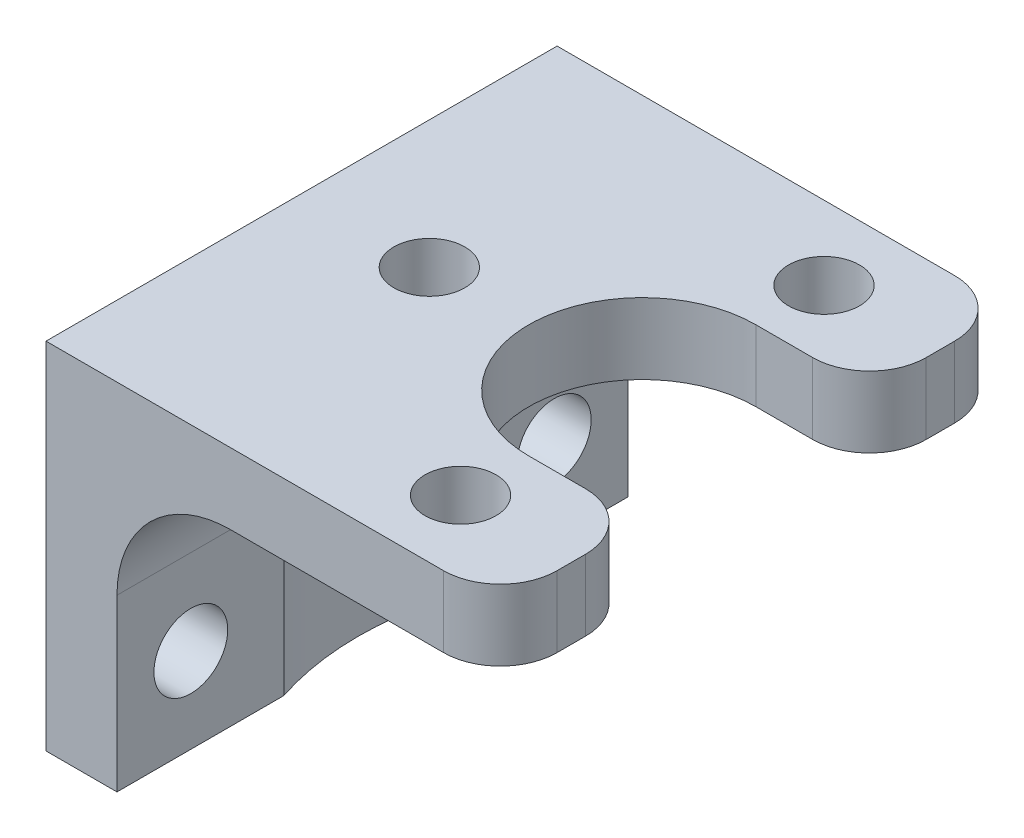
from build123d import *

# Parameters (mm, degrees)
SKETCH1_W           = 20.32
SKETCH1_H           = 22.86
BOSS_EXTRUDE1_DEPTH = 3.175
FILLET1_R           = 2.54
FILLET2_R           = 2.54
CUT_EXTRUDE2_DEPTH  = 16.618934823
FILLET3_R           = 2.54
FILLET4_R           = 2.54
SKETCH4_W           = 3.175
SKETCH4_H           = 22.86
BOSS_EXTRUDE2_DEPTH = 12.7
FILLET6_R           = 5.08
SKETCH3_R           = 1.5875
CUT_EXTRUDE3_DEPTH  = 6.35
SKETCH5_R           = 12.7
CUT_EXTRUDE4_DEPTH  = 20.878644377
SKETCH6_R           = 1.651
CUT_EXTRUDE5_DEPTH  = 25.205080661


with BuildPart() as part:
    # Sketch1 → Boss-Extrude1 (new body)
    with BuildSketch(Plane(origin=(0, 0, 0), x_dir=(1, 0, 0), z_dir=(0, 1, 0))):
        Rectangle(SKETCH1_W, SKETCH1_H)
    extrude(amount=BOSS_EXTRUDE1_DEPTH)

    # Fillet1
    fillet1_edges = [part.edges().sort_by_distance(p)[0] for p in [
        (10.16, 1.5875, -11.43),
    ]]
    fillet(fillet1_edges, radius=FILLET1_R)

    # Fillet2
    fillet2_edges = [part.edges().sort_by_distance(p)[0] for p in [
        (10.16, 1.5875, 11.43),
    ]]
    fillet(fillet2_edges, radius=FILLET2_R)

    # Sketch2 → Cut-Extrude2 (cut, through all)
    with BuildSketch(Plane.XZ):
        with BuildLine():
            Line((5.08, -5.08), (10.16, -5.08))
            Line((10.16, -5.08), (10.16, 5.08))
            Line((10.16, 5.08), (5.08, 5.08))
            ThreePointArc((5.08, 5.08), (0, 0), (5.08, -5.08))
        make_face()
    extrude(amount=-CUT_EXTRUDE2_DEPTH, mode=Mode.SUBTRACT)

    # Fillet3
    fillet3_edges = [part.edges().sort_by_distance(p)[0] for p in [
        (10.16, 1.5875, 5.08),
    ]]
    fillet(fillet3_edges, radius=FILLET3_R)

    # Fillet4
    fillet4_edges = [part.edges().sort_by_distance(p)[0] for p in [
        (10.16, 1.5875, -5.08),
    ]]
    fillet(fillet4_edges, radius=FILLET4_R)

    # Sketch4 → Boss-Extrude2 (add)
    with BuildSketch(Plane.XZ):
        with Locations((-8.5725, 0)):
            Rectangle(SKETCH4_W, SKETCH4_H)
    extrude(amount=BOSS_EXTRUDE2_DEPTH)

    # Fillet6
    fillet6_edges = [part.edges().sort_by_distance(p)[0] for p in [
        (-6.985, 0, 0),
    ]]
    fillet(fillet6_edges, radius=FILLET6_R)

    # Sketch3 → Cut-Extrude3 (cut, symmetric)
    with BuildSketch(Plane.XZ):
        with Locations((5.08, 8.128)):
            Circle(SKETCH3_R)
        with Locations((5.08, -8.128)):
            Circle(SKETCH3_R)
        with Locations((-4.445, 0)):
            Circle(SKETCH3_R)
    extrude(amount=CUT_EXTRUDE3_DEPTH, both=True, mode=Mode.SUBTRACT)

    # Sketch5 → Cut-Extrude4 (cut, through all)
    with BuildSketch(Plane.XZ):
        with Locations((5.08, 0)):
            Circle(SKETCH5_R)
    extrude(amount=CUT_EXTRUDE4_DEPTH, mode=Mode.SUBTRACT)

    # Sketch6 → Cut-Extrude5 (cut, through all)
    with BuildSketch(Plane(origin=(-6.985, 0, 0), x_dir=(0, 0, -1), z_dir=(1, 0, 0))):
        with Locations((-8.128, -8.89)):
            Circle(SKETCH6_R)
        with Locations((8.128, -8.89)):
            Circle(SKETCH6_R)
    extrude(amount=-CUT_EXTRUDE5_DEPTH, mode=Mode.SUBTRACT)


solid = part.part
